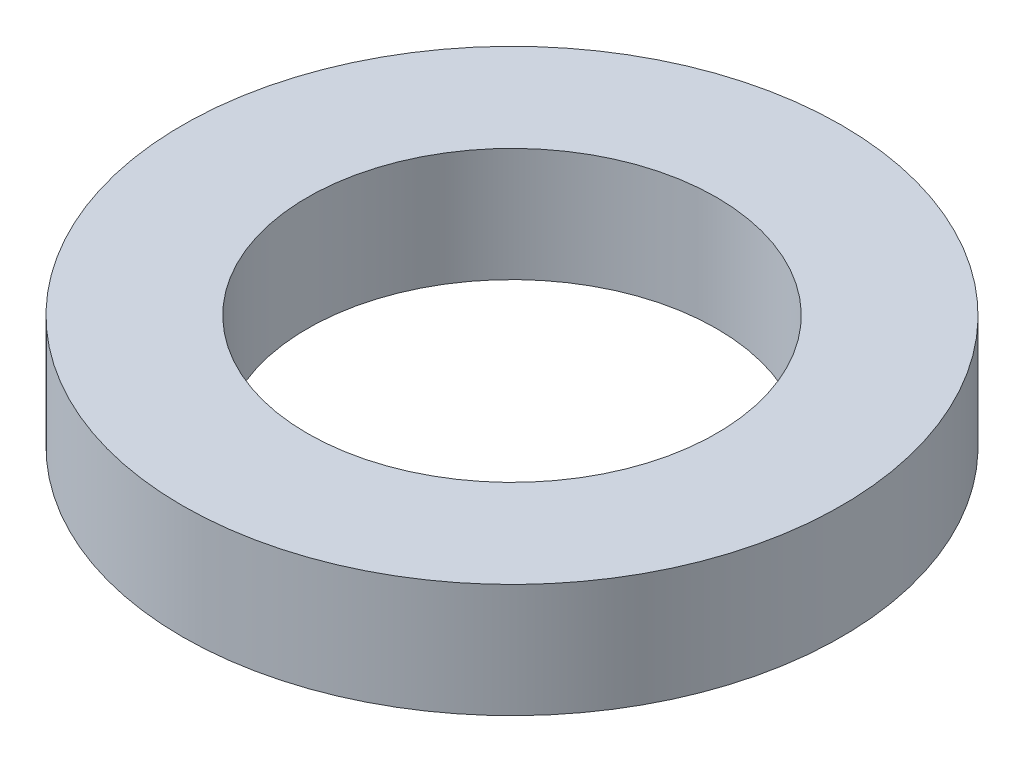
from build123d import *

# Parameters (mm, degrees)
SKETCH1_R           = 72.5
BOSS_EXTRUDE1_DEPTH = 25
SKETCH2_R           = 45
CUT_EXTRUDE1_DEPTH  = 106.534354596


with BuildPart() as part:
    # Sketch1 → Boss-Extrude1 (new body)
    with BuildSketch(Plane(origin=(0, 0, 0), x_dir=(1, 0, 0), z_dir=(0, 1, 0))):
        Circle(SKETCH1_R)
    extrude(amount=BOSS_EXTRUDE1_DEPTH)

    # Sketch2 → Cut-Extrude1 (cut, through all)
    with BuildSketch(Plane(origin=(0, 0, 0), x_dir=(1, 0, 0), z_dir=(0, 1, 0))):
        Circle(SKETCH2_R)
    extrude(amount=CUT_EXTRUDE1_DEPTH, mode=Mode.SUBTRACT)


solid = part.part
